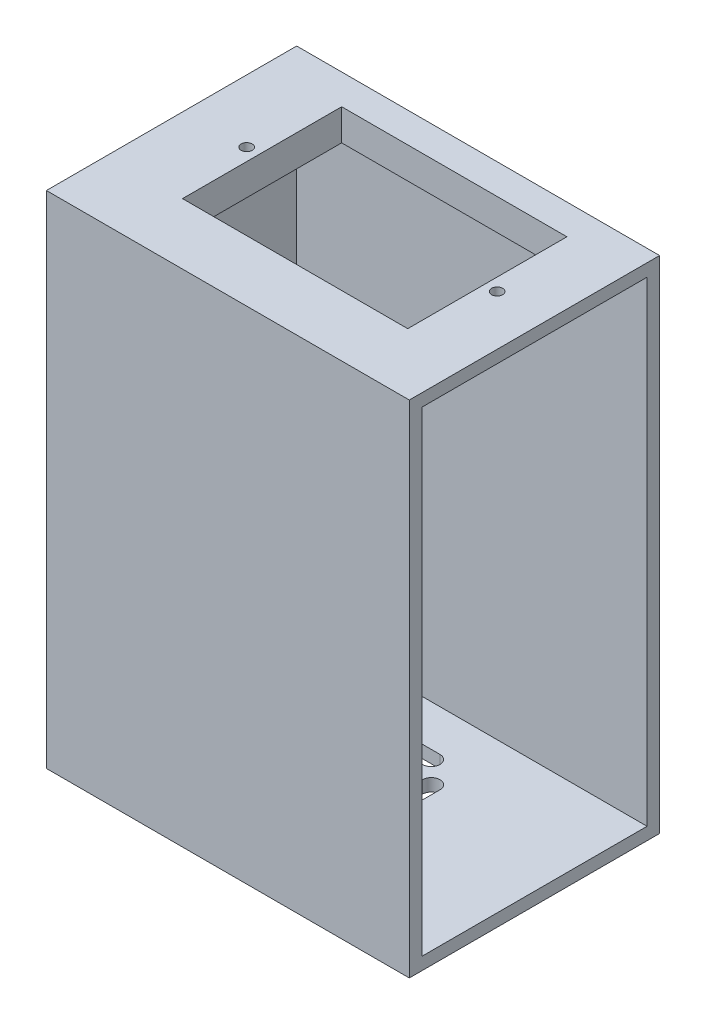
from build123d import *

# Parameters (mm, degrees)
SKETCH1_W                    = 76.2
SKETCH1_H                    = 101.6
BODY_DEPTH                   = 50.8
SKETCH2_W                    = 45.72
SKETCH2_H                    = 32.3088
CAMERA_HOLE_DEPTH            = 6.35
HOLLOW_START                 = -35.56
HOLLOW_DEPTH                 = 71.12
HOLLOW_2_OUTLINE_W           = 3.81
HOLLOW_2_OUTLINE_H           = 37.3888
HOLLOW_2_DEPTH               = 10.16
HOLLOW_START_2               = 25.4
HOLLOW_3_OUTLINE_W           = 3.81
HOLLOW_3_OUTLINE_H           = 37.3888
HOLLOW_3_DEPTH               = 10.16
SINGLE_BUTTON_LEG_HOLE_REACH = 121.812
ALL_BUTTON_HOLES_COUNT       = 4
SKETCH5_W                    = 50.8
SKETCH5_H                    = 101.6
LET_FOLKS_SEE_IN_DEPTH       = 2.54
F_4_40_TAPPED_HOLE1_D        = 2.2606
F_4_40_TAPPED_HOLE1_DEPTH    = 7.62
F_4_40_TAPPED_HOLE1_TIP      = 0.679152758


# Read off the part's stored shape, not the designer's step: hollow
with BuildPart() as part:
    # Sketch1 → body (new body)
    with BuildSketch(Plane.XY):
        Rectangle(SKETCH1_W, SKETCH1_H)
    extrude(amount=BODY_DEPTH)

    # Sketch2 → camera hole (cut)
    with BuildSketch(Plane(origin=(0, 50.8, 0), x_dir=(1, 0, 0), z_dir=(0, 1, 0))):
        with Locations((0, -22.264701422)):
            Rectangle(SKETCH2_W, SKETCH2_H)
    extrude(amount=-CAMERA_HOLE_DEPTH, mode=Mode.SUBTRACT)

    # hollow outline → hollow (cut)
    with BuildSketch(Plane.YZ.offset(HOLLOW_START)):
        Polygon((48.26, 40.959101422), (48.26, 48.26), (-48.26, 48.26), (-48.26, 2.54), (48.26, 2.54), (48.26, 3.570301422), (44.45, 3.570301422), (44.45, 40.959101422), align=None)
    extrude(amount=HOLLOW_DEPTH, mode=Mode.SUBTRACT)

    # hollow 2 outline → hollow 2 (cut)
    with BuildSketch(Plane.YZ.offset(HOLLOW_START)):
        with Locations((46.355, 22.264701422)):
            Rectangle(HOLLOW_2_OUTLINE_W, HOLLOW_2_OUTLINE_H)
    extrude(amount=HOLLOW_2_DEPTH, mode=Mode.SUBTRACT)

    # hollow 3 outline → hollow 3 (cut)
    with BuildSketch(Plane.YZ.offset(HOLLOW_START_2)):
        with Locations((46.355, 22.264701422)):
            Rectangle(HOLLOW_3_OUTLINE_W, HOLLOW_3_OUTLINE_H)
    extrude(amount=HOLLOW_3_DEPTH, mode=Mode.SUBTRACT)

    # Sketch4 → single button leg hole (cut, up to next)
    with BuildSketch(Plane.XZ.offset(50.8), mode=Mode.PRIVATE) as single_button_leg_hole_sk1:
        with BuildLine():
            Line((8.128, 20.955), (8.128, 17.145))
            ThreePointArc((8.128, 17.145), (6.35, 15.367), (4.572, 17.145))
            Line((4.572, 17.145), (4.572, 20.955))
            ThreePointArc((4.572, 20.955), (6.35, 22.733), (8.128, 20.955))
        make_face()
    single_button_leg_hole_tool1 = extrude(single_button_leg_hole_sk1.sketch, amount=-SINGLE_BUTTON_LEG_HOLE_REACH, mode=Mode.PRIVATE) & part.part
    single_button_leg_hole = single_button_leg_hole_tool1.solids().sort_by_distance((6.35, -50.8, 19.05))[0]
    add(single_button_leg_hole, mode=Mode.SUBTRACT)

    # all button holes: single button leg hole ×4 about axis
    all_button_holes_axis = Axis((0, 0, 19.05), (0, 1, 0))
    for i in range(1, ALL_BUTTON_HOLES_COUNT):
        add(single_button_leg_hole.rotate(all_button_holes_axis, i * 360 / ALL_BUTTON_HOLES_COUNT), mode=Mode.SUBTRACT)

    # Sketch5 → let folks see in (cut)
    with BuildSketch(Plane(origin=(38.1, 0, 0), x_dir=(0, 0, -1), z_dir=(1, 0, 0))):
        with Locations((-25.4, 0)):
            Rectangle(SKETCH5_W, SKETCH5_H)
    extrude(amount=-LET_FOLKS_SEE_IN_DEPTH, mode=Mode.SUBTRACT)

    # #4-40 Tapped Hole1
    with Locations(Plane(origin=(0, 50.8, 0), x_dir=(1, 0, 0), z_dir=(0, 1, 0))):
        with Locations((-25.4, -22.86), (25.4, -22.816885961)):
            Hole(F_4_40_TAPPED_HOLE1_D / 2, depth=F_4_40_TAPPED_HOLE1_DEPTH)
            with Locations((0, 0, -(F_4_40_TAPPED_HOLE1_DEPTH + F_4_40_TAPPED_HOLE1_TIP / 2))):  # 118° drill point
                Cone(0, F_4_40_TAPPED_HOLE1_D / 2, F_4_40_TAPPED_HOLE1_TIP, mode=Mode.SUBTRACT)


solid = part.part
